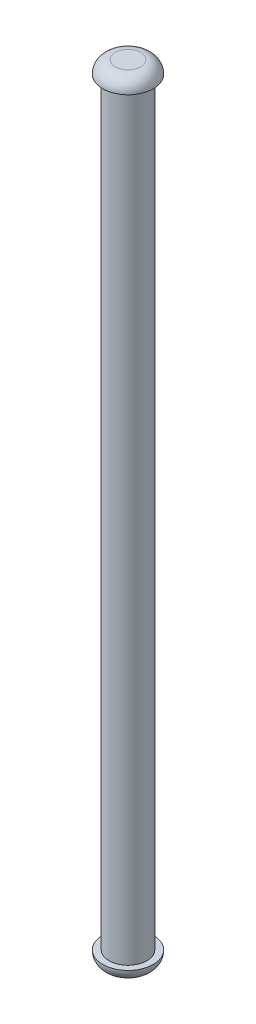
from build123d import *

# Parameters (mm, degrees)
SZKIC1_R                    = 1.5
DODANIE_WYCI_GNI_CIE1_DEPTH = 60
SZKIC2_R                    = 2
DODANIE_WYCI_GNI_CIE2_DEPTH = 1
ZAOKR_GLENIE1_R             = 1
DODANIE_WYCI_GNI_CIE3_START = 1
SZKIC3_R                    = 2
DODANIE_WYCI_GNI_CIE3_DEPTH = 1
ZAOKR_GLENIE2_R             = 1


with BuildPart() as part:
    # Szkic1 → Dodanie-wyciągnięcie1 (new body)
    with BuildSketch(Plane(origin=(0, 0, 0), x_dir=(1, 0, 0), z_dir=(0, 1, 0))):
        with Locations(Location((0, 0, 0), (0, 0, 270))):
            Circle(SZKIC1_R)
    extrude(amount=DODANIE_WYCI_GNI_CIE1_DEPTH)

    # Szkic2 → Dodanie-wyciągnięcie2 (add)
    with BuildSketch(Plane(origin=(0, 60, 0), x_dir=(1, 0, 0), z_dir=(0, 1, 0))):
        with Locations(Location((0, 0, 0), (0, 0, 270))):
            Circle(SZKIC2_R)
    extrude(amount=DODANIE_WYCI_GNI_CIE2_DEPTH)

    # Zaokrąglenie1
    zaokr_glenie1_edges = [part.edges().sort_by_distance(p)[0] for p in [
        (0, 61, -2),
    ]]
    fillet(zaokr_glenie1_edges, radius=ZAOKR_GLENIE1_R - 0.0001)  # a hair under: the kernel refuses the full size

    # Szkic3 → Dodanie-wyciągnięcie3 (add)
    with BuildSketch(Plane.XZ.offset(DODANIE_WYCI_GNI_CIE3_START)):
        with Locations(Location((0, 0, 0), (0, 0, 270))):
            Circle(SZKIC3_R)
    extrude(amount=-DODANIE_WYCI_GNI_CIE3_DEPTH)

    # Zaokrąglenie2
    zaokr_glenie2_edges = [part.edges().sort_by_distance(p)[0] for p in [
        (0, -1, 2),
    ]]
    fillet(zaokr_glenie2_edges, radius=ZAOKR_GLENIE2_R - 0.0001)  # a hair under: the kernel refuses the full size


solid = part.part
